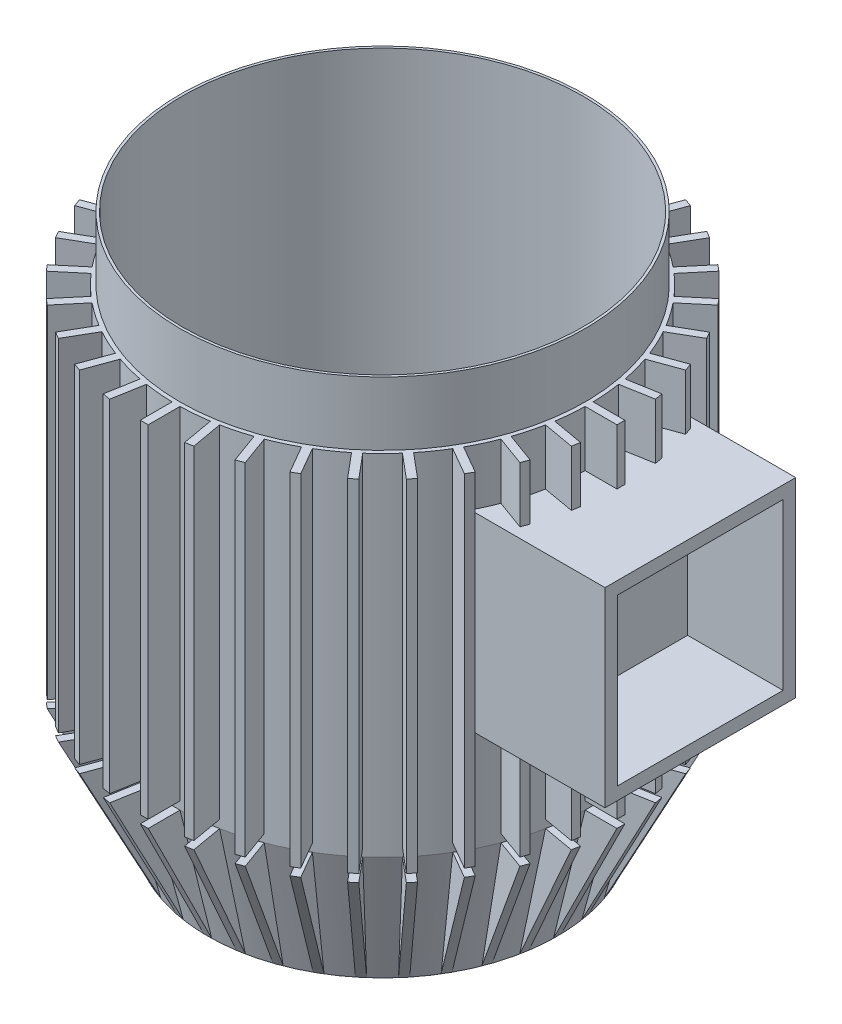
from build123d import *

# Parameters (mm, degrees)
SKETCH2_R           = 6.5
BOSS_EXTRUDE1_DEPTH = 17
CHAMFER3_SIZE       = 1
CHAMFER3_SIZE2      = 4
SHELL2_T            = -0.2
BOSS_EXTRUDE2_REACH = 24.962
SKETCH4_W           = 0.25
SKETCH4_H           = 17
CIRPATTERN1_COUNT   = 36
SKETCH6_R           = 1
CUT_EXTRUDE1_DEPTH  = 21.03746491
BOSS_EXTRUDE3_REACH = 27.524
SKETCH7_W           = 6
SKETCH7_H           = 6
SKETCH8_W           = 5.2
SKETCH8_H           = 5.2
CUT_EXTRUDE10_DEPTH = 3
SKETCH9_W           = 1.6216394
SKETCH9_H           = 2


with BuildPart() as part:
    # Sketch2 → Boss-Extrude1 (new body)
    with BuildSketch(Plane(origin=(0, 0, 0), x_dir=(1, 0, 0), z_dir=(0, 1, 0))):
        Circle(SKETCH2_R)
    extrude(amount=-BOSS_EXTRUDE1_DEPTH)

    # Chamfer3
    chamfer3_edges = [part.edges().sort_by_distance(p)[0] for p in [
        (-6.5, -17, 0),
    ]]
    chamfer3_side = [part.faces().sort_by_distance(p)[0] for p in [
        (0, -17, 0),
    ]]
    chamfer(chamfer3_edges, length=CHAMFER3_SIZE, length2=CHAMFER3_SIZE2, reference=chamfer3_side[0])

    # Shell2
    shell2_openings = [part.faces().sort_by_distance(p)[0] for p in [
        (0, 0, 0),
    ]]
    offset(amount=SHELL2_T, openings=shell2_openings, kind=Kind.INTERSECTION)

    # Sketch4 → Boss-Extrude2 (add, up to next)
    with BuildSketch(Plane.XY.offset(7.5), mode=Mode.PRIVATE) as boss_extrude2_sk1:
        with Locations((0, -8.5)):
            Rectangle(SKETCH4_W, SKETCH4_H)
    boss_extrude2_tool1 = extrude(boss_extrude2_sk1.sketch, amount=-BOSS_EXTRUDE2_REACH, mode=Mode.PRIVATE) - part.part
    boss_extrude2 = boss_extrude2_tool1.solids().sort_by_distance((0, -8.5, 7.5))[0]
    add(boss_extrude2)

    # CirPattern1: Boss-Extrude2 ×36 about axis
    cirpattern1_axis = Axis((0, -17, 0), (0, 1, 0))
    for i in range(1, CIRPATTERN1_COUNT):
        add(boss_extrude2.rotate(cirpattern1_axis, i * 360 / CIRPATTERN1_COUNT))

    # Sketch5 → Cut-Revolve1 (revolve, cut)
    with BuildSketch(Plane.XY):
        Polygon((7.5, -13), (5.498579362, -17), (7.998579362, -17.75), (7.998579362, -12.75), (6.5, -12.75), (6.5, -13), align=None)
    revolve(axis=Axis((0, 0, 0), (0, -1, 0)), mode=Mode.SUBTRACT)

    # Sketch6 → Cut-Extrude1 (cut, through all)
    with BuildSketch(Plane.XZ.offset(17)):
        Circle(SKETCH6_R)
    extrude(amount=-CUT_EXTRUDE1_DEPTH, mode=Mode.SUBTRACT)

    # Sketch7 → Boss-Extrude3 (add, up to next)
    with BuildSketch(Plane(origin=(10, 0, 0), x_dir=(0, 0, -1), z_dir=(1, 0, 0)), mode=Mode.PRIVATE) as boss_extrude3_sk1:
        with Locations((0, -6.75)):
            Rectangle(SKETCH7_W, SKETCH7_H)
    boss_extrude3_tool1 = extrude(boss_extrude3_sk1.sketch, amount=-BOSS_EXTRUDE3_REACH, mode=Mode.PRIVATE) - part.part
    add(boss_extrude3_tool1.solids().sort_by_distance((10, -6.75, 0))[0])

    # Sketch8 → Cut-Extrude10 (cut)
    with BuildSketch(Plane(origin=(10, 0, 0), x_dir=(0, 0, -1), z_dir=(1, 0, 0))):
        with Locations((0, -6.75)):
            Rectangle(SKETCH8_W, SKETCH8_H)
    extrude(amount=-CUT_EXTRUDE10_DEPTH, mode=Mode.SUBTRACT)

    # Sketch9 → Cut-Revolve2 (revolve, cut)
    with BuildSketch(Plane(origin=(0, 0, 0), x_dir=(0, 0, -1), z_dir=(1, 0, 0))):
        with Locations((-7.1891803, -1)):
            Rectangle(SKETCH9_W, SKETCH9_H)
    revolve(axis=Axis((0, 0, 0), (0, -1, 0)), mode=Mode.SUBTRACT)


solid = part.part
